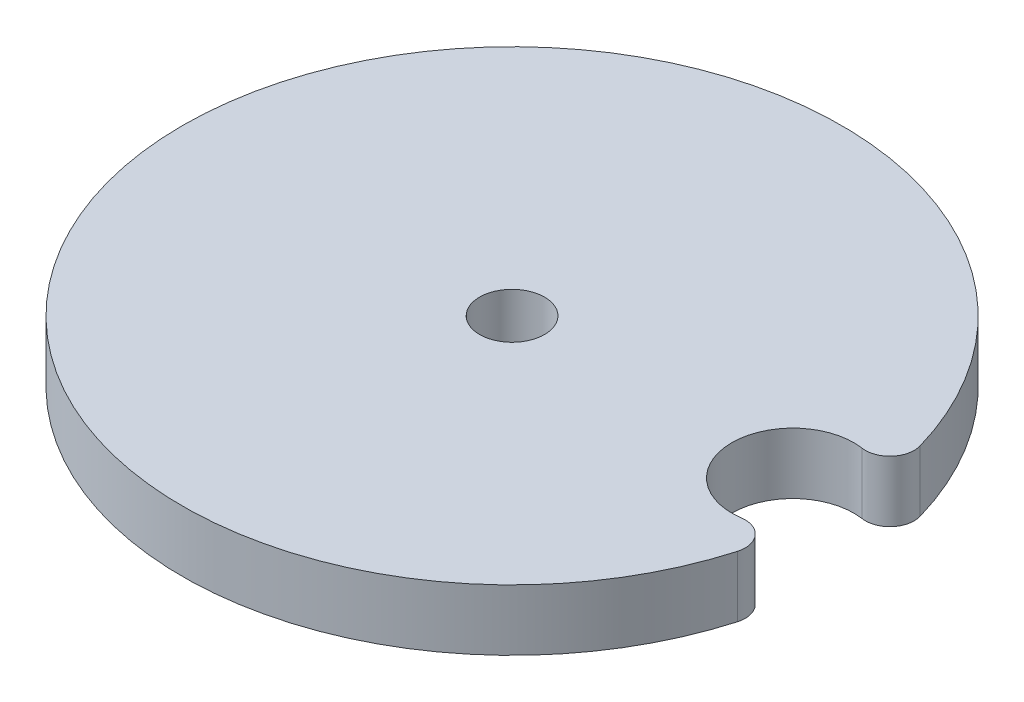
from build123d import *

# Parameters (mm, degrees)
BOSS_EXTRUDE1_DEPTH     = 6.35
F_1_4_CLEARANCE_HOLE1_D = 6.7564
FILLET1_R               = 2.54


with BuildPart() as part:
    # Sketch1 → Boss-Extrude1 (new body)
    with BuildSketch(Plane(origin=(0, 0, 0), x_dir=(1, 0, 0), z_dir=(0, 1, 0))):
        with BuildLine():
            ThreePointArc((34.041521739, -4.120545799), (22.86, 0), (34.041521739, 4.120545799))
            ThreePointArc((34.041521739, 4.120545799), (-34.29, 0), (34.041521739, -4.120545799))
        make_face()
    extrude(amount=BOSS_EXTRUDE1_DEPTH)

    # 1/4 Clearance Hole1 (through all)
    with Locations(Plane(origin=(0, 6.35, 0), x_dir=(1, 0, 0), z_dir=(0, 1, 0))):
        with Locations((0, 0)):
            Hole(F_1_4_CLEARANCE_HOLE1_D / 2)

    # Fillet1
    fillet1_edges = [part.edges().sort_by_distance(p)[0] for p in [
        (34.041521739, 3.175, 4.120545799),
        (34.041521739, 3.175, -4.120545799),
    ]]
    fillet(fillet1_edges, radius=FILLET1_R)


solid = part.part
